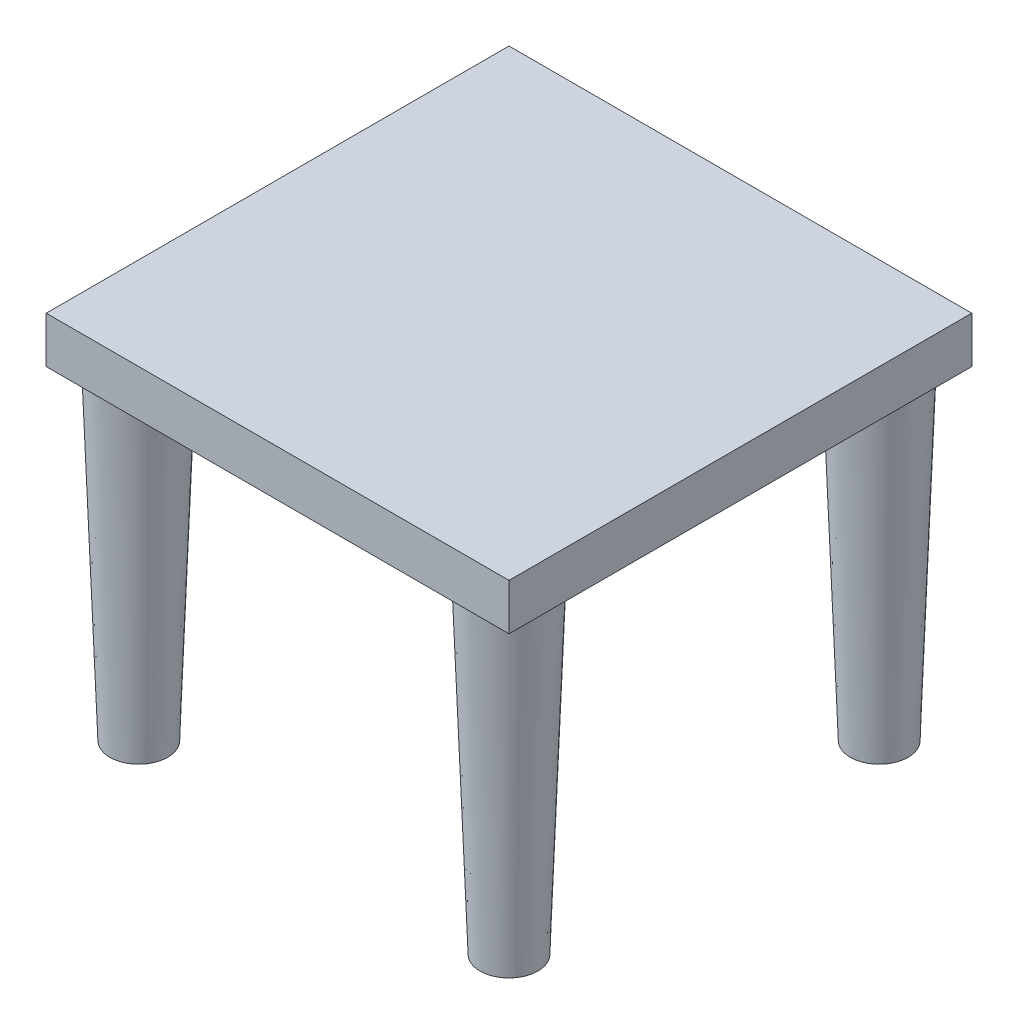
from build123d import *

# Parameters (mm, degrees)
SKETCH1_W           = 100
SKETCH1_H           = 100
BOSS_EXTRUDE1_DEPTH = 5
SKETCH2_4_R         = 8.75
SKETCH3_3_R         = 6.25
SKETCH2_5_R         = 8.75
SKETCH3_4_R         = 6.25
SKETCH2_6_R         = 8.75
SKETCH3_5_R         = 6.25


with BuildPart() as part:
    # Sketch1 → Boss-Extrude1 (new, symmetric)
    with BuildSketch(Plane(origin=(0, 0, 0), x_dir=(1, 0, 0), z_dir=(0, 1, 0))):
        Rectangle(SKETCH1_W, SKETCH1_H)
    extrude(amount=BOSS_EXTRUDE1_DEPTH, both=True)

    # Loft1: read off the stored shape, not the designer's step
    # Loft1: loft between two sections, ruled curve by curve
    loft1_from = [
        Edge.make_bspline([(-44.368650168, -5, -32.418615185), (-59.531419798, -5, -41.15591552), (-50.794119462, -5, -56.31868515), (-35.631349832, -5, -47.581384815), (-20.468580202, -5, -38.84408448), (-29.205880538, -5, -23.68131485), (-44.368650168, -5, -32.418615185)], [0, 0, 0, 0, 0.5, 0.5, 0.5, 1, 1, 1, 1], 3, [1, 0.333333333, 0.333333333, 1, 0.333333333, 0.333333333, 1]),
    ]
    loft1_to = [
        Edge.make_bspline([(-41.905194087, -75, -34.047459745), (-53.810274598, -75, -37.857847919), (-49.999886423, -75, -49.76292843), (-38.094805913, -75, -45.952540255), (-26.189725402, -75, -42.142152081), (-30.000113577, -75, -30.23707157), (-41.905194087, -75, -34.047459745)], [0, 0, 0, 0, 0.5, 0.5, 0.5, 1, 1, 1, 1], 3, [1, 0.333333333, 0.333333333, 1, 0.333333333, 0.333333333, 1]),
    ]
    loft1 = Solid(Shell([*[Face.make_surface_from_curves(loft1_from[k], loft1_to[k]) for k in range(1)], Face(Wire(loft1_from)), Face(Wire(loft1_to))]))
    add(loft1)

    # Sketch2<4> → Loft2 section 0
    with BuildSketch(Plane.XZ.offset(5)):
        with Locations((-40, 40)):
            Circle(SKETCH2_4_R)
    # Sketch3<3> → Loft2 section 1
    with BuildSketch(Plane(origin=(0, -75, 0), x_dir=(1, 0, 0), z_dir=(0, 1, 0))):
        with Locations((-40, -40)):
            Circle(SKETCH3_3_R)
    loft()

    # Sketch2<5> → Loft3 section 0
    with BuildSketch(Plane.XZ.offset(5)):
        with Locations((40, 40)):
            Circle(SKETCH2_5_R)
    # Sketch3<4> → Loft3 section 1
    with BuildSketch(Plane(origin=(0, -75, 0), x_dir=(1, 0, 0), z_dir=(0, 1, 0))):
        with Locations((40, -40)):
            Circle(SKETCH3_4_R)
    loft()

    # Sketch2<6> → Loft4 section 0
    with BuildSketch(Plane.XZ.offset(5)):
        with Locations((40, -40)):
            Circle(SKETCH2_6_R)
    # Sketch3<5> → Loft4 section 1
    with BuildSketch(Plane(origin=(0, -75, 0), x_dir=(1, 0, 0), z_dir=(0, 1, 0))):
        with Locations((40, 40)):
            Circle(SKETCH3_5_R)
    loft()


solid = part.part
